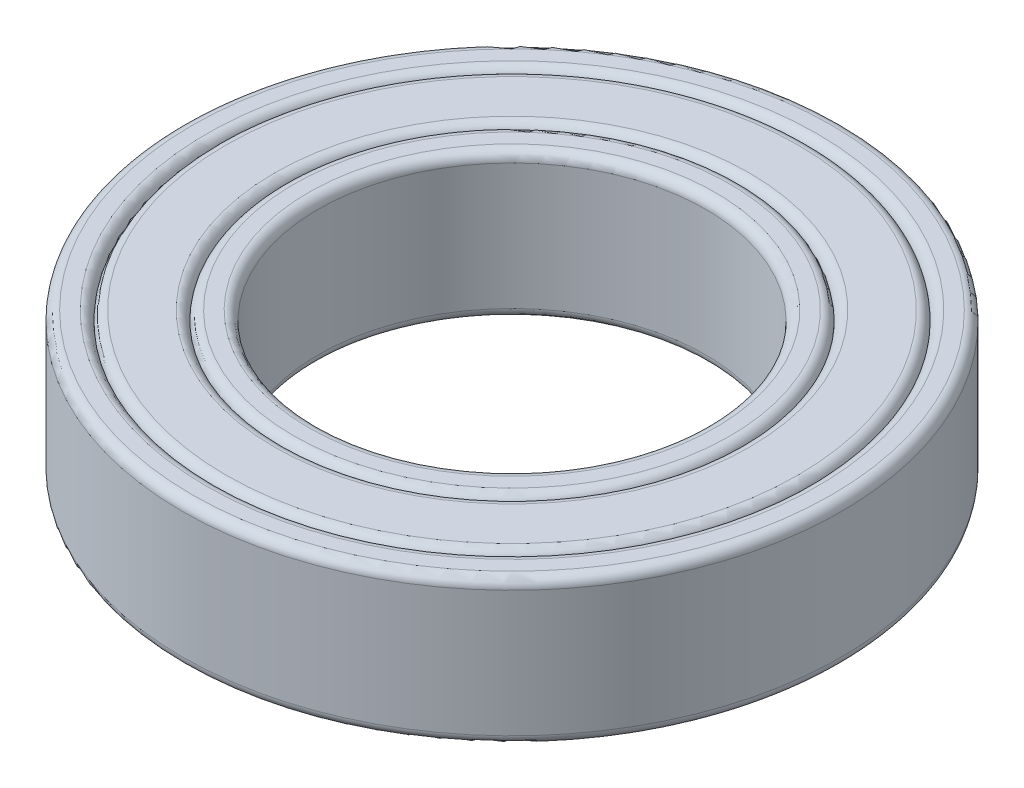
from build123d import *

# Parameters (mm, degrees)
SKETCH1_R                = 34
BOSS_EXTRUDE1_DEPTH      = 7.5
FILLET1_R                = 1
CUT_EXTRUDE1_DEPTH       = 49.664669048
CUT_EXTRUDE1_DEPTH_BACK  = 49.664669048
SKETCH2_R                = 30.5
FILLET2_R                = 1
BOSS_EXTRUDE2_DEPTH      = 7.5
BOSS_EXTRUDE2_DEPTH_BACK = 7.5
SKETCH3_R                = 30.5
FILLET3_R                = 1
CUT_EXTRUDE2_DEPTH       = 49.664669048
CUT_EXTRUDE2_DEPTH_BACK  = 49.664669048
SKETCH4_R                = 23.5
FILLET4_R                = 1
BOSS_EXTRUDE3_DEPTH      = 7.5
BOSS_EXTRUDE3_DEPTH_BACK = 7.5
SKETCH5_R                = 23.5
FILLET5_R                = 1
CUT_EXTRUDE3_DEPTH       = 49.664669048
CUT_EXTRUDE3_DEPTH_BACK  = 49.664669048
SKETCH6_R                = 20
FILLET6_R                = 1


with BuildPart() as part:
    # Sketch1 → Boss-Extrude1 (new, symmetric)
    with BuildSketch(Plane(origin=(0, 0, 0), x_dir=(1, 0, 0), z_dir=(0, 1, 0))):
        with Locations(Location((0, 0, 0), (0, 0, 270))):
            Circle(SKETCH1_R)
    extrude(amount=BOSS_EXTRUDE1_DEPTH, both=True)

    # Fillet1
    fillet1_edges = [part.edges().sort_by_distance(p)[0] for p in [
        (0, -7.5, -34),
        (0, 7.5, -34),
    ]]
    fillet(fillet1_edges, radius=FILLET1_R)

    # Sketch2 → Cut-Extrude1 (cut, two sides: drawn at the far end of the back side and taken through both)
    with BuildSketch(Plane(origin=(0, 0, 0), x_dir=(1, 0, 0), z_dir=(0, 1, 0)).offset(-CUT_EXTRUDE1_DEPTH_BACK)):
        with Locations(Location((0, 0, 0), (0, 0, 270))):
            Circle(SKETCH2_R)
    extrude(amount=CUT_EXTRUDE1_DEPTH + CUT_EXTRUDE1_DEPTH_BACK, mode=Mode.SUBTRACT)

    # Fillet2
    fillet2_edges = [part.edges().sort_by_distance(p)[0] for p in [
        (0, -7.5, -30.5),
        (0, 7.5, -30.5),
    ]]
    fillet(fillet2_edges, radius=FILLET2_R)

    # Sketch3 → Boss-Extrude2 (add, two sides: drawn at the far end of the back side and taken through both)
    with BuildSketch(Plane(origin=(0, 0, 0), x_dir=(1, 0, 0), z_dir=(0, 1, 0)).offset(-BOSS_EXTRUDE2_DEPTH_BACK)):
        with Locations(Location((0, 0, 0), (0, 0, 270))):
            Circle(SKETCH3_R)
    extrude(amount=BOSS_EXTRUDE2_DEPTH + BOSS_EXTRUDE2_DEPTH_BACK)

    # Fillet3
    fillet3_edges = [part.edges().sort_by_distance(p)[0] for p in [
        (0, -7.5, -30.5),
        (0, 7.5, -30.5),
    ]]
    fillet(fillet3_edges, radius=FILLET3_R - 0.0001)  # a hair under: the kernel refuses the full size

    # Sketch4 → Cut-Extrude2 (cut, two sides: drawn at the far end of the back side and taken through both)
    with BuildSketch(Plane(origin=(0, 0, 0), x_dir=(1, 0, 0), z_dir=(0, 1, 0)).offset(-CUT_EXTRUDE2_DEPTH_BACK)):
        with Locations(Location((0, 0, 0), (0, 0, 270))):
            Circle(SKETCH4_R)
    extrude(amount=CUT_EXTRUDE2_DEPTH + CUT_EXTRUDE2_DEPTH_BACK, mode=Mode.SUBTRACT)

    # Fillet4
    fillet4_edges = [part.edges().sort_by_distance(p)[0] for p in [
        (0, -7.5, -23.5),
        (0, 7.5, -23.5),
    ]]
    fillet(fillet4_edges, radius=FILLET4_R)

    # Sketch5 → Boss-Extrude3 (add, two sides: drawn at the far end of the back side and taken through both)
    with BuildSketch(Plane(origin=(0, 0, 0), x_dir=(1, 0, 0), z_dir=(0, 1, 0)).offset(-BOSS_EXTRUDE3_DEPTH_BACK)):
        with Locations(Location((0, 0, 0), (0, 0, 270))):
            Circle(SKETCH5_R)
    extrude(amount=BOSS_EXTRUDE3_DEPTH + BOSS_EXTRUDE3_DEPTH_BACK)

    # Fillet5
    fillet5_edges = [part.edges().sort_by_distance(p)[0] for p in [
        (0, -7.5, -23.5),
        (0, 7.5, -23.5),
    ]]
    fillet(fillet5_edges, radius=FILLET5_R - 0.0001)  # a hair under: the kernel refuses the full size

    # Sketch6 → Cut-Extrude3 (cut, two sides: drawn at the far end of the back side and taken through both)
    with BuildSketch(Plane(origin=(0, 0, 0), x_dir=(1, 0, 0), z_dir=(0, 1, 0)).offset(-CUT_EXTRUDE3_DEPTH_BACK)):
        with Locations(Location((0, 0, 0), (0, 0, 270))):
            Circle(SKETCH6_R)
    extrude(amount=CUT_EXTRUDE3_DEPTH + CUT_EXTRUDE3_DEPTH_BACK, mode=Mode.SUBTRACT)

    # Fillet6
    fillet6_edges = [part.edges().sort_by_distance(p)[0] for p in [
        (0, -7.5, -20),
        (0, 7.5, -20),
    ]]
    fillet(fillet6_edges, radius=FILLET6_R)


solid = part.part
